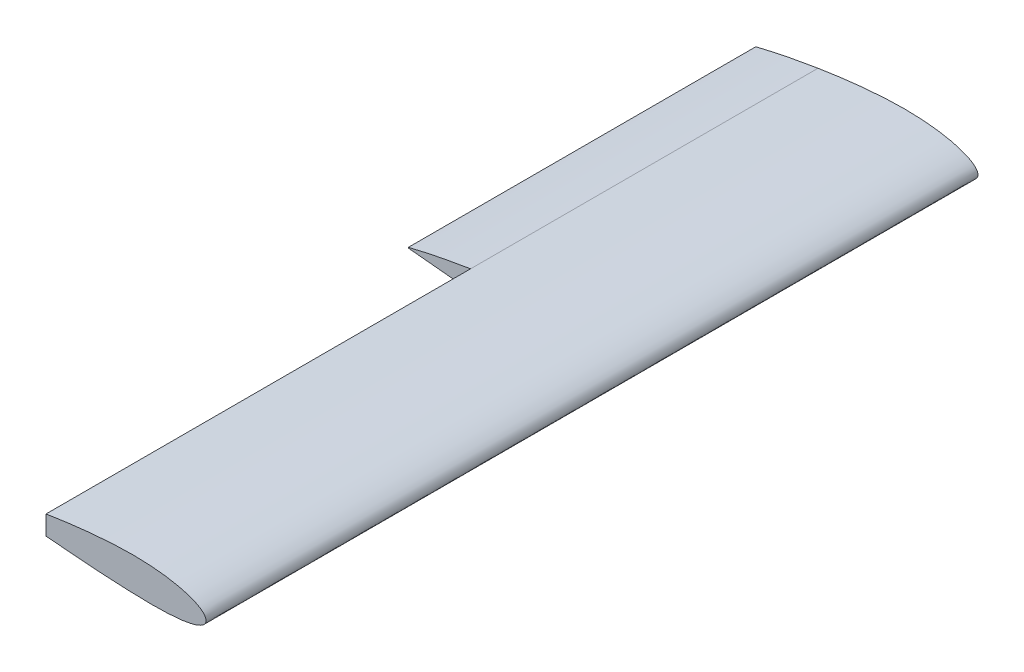
from build123d import *

# Parameters (mm, degrees)
BOSS_EXTRUDE1_DEPTH = 1120
BOSS_EXTRUDE2_DEPTH = 504
SKETCH3_R           = 12.7
CUT_EXTRUDE1_DEPTH  = 801
SKETCH4_W           = 32
SKETCH4_H           = 40.882
CUT_EXTRUDE2_DEPTH  = 46
SKETCH5_W           = 60
SKETCH5_H           = 12
CUT_EXTRUDE3_DEPTH  = 46
SKETCH6_W           = 54
SKETCH6_H           = 29.1
CUT_EXTRUDE4_DEPTH  = 64
SKETCH7_W           = 20.4
SKETCH7_H           = 6.8
CUT_EXTRUDE5_DEPTH  = 26


with BuildPart() as part:
    # Sketch1 → Boss-Extrude1 (new body)
    with BuildSketch(Plane.XY):
        with BuildLine():
            Line((-232.07976, 18.640331755), (-232.07976, -9.299539429))
            add(Edge.make_bspline(
                [(-232.07976, 18.640331755), (-229.164273263, 19.105137392), (-222.291133752, 20.200897474), (-211.337542784, 21.800276655), (-199.146674743, 23.458907068), (-186.709533826, 24.99775787), (-174.104063941, 26.396384265), (-161.408619673, 27.628181699), (-148.702826871, 28.669998803), (-136.048616227, 29.498668375), (-123.502304929, 30.100378699), (-111.141296499, 30.381034684), (-99.066442851, 30.337763188), (-87.381824011, 29.96392256), (-76.165988678, 29.262541202), (-65.494170353, 28.242118376), (-55.437562328, 26.917551706), (-46.062520993, 25.309550624), (-37.429846456, 23.444065126), (-29.594109363, 21.3513396), (-22.603015821, 19.064676337), (-16.496733591, 16.618893003), (-11.307130205, 14.048195179), (-7.056738632, 11.383320116), (-3.758682454, 8.645345207), (-1.421067217, 5.837729222), (-0.076519927, 2.93397469), (0.175352503, -0.017611891), (-0.655158047, -2.858555013), (-2.530689177, -5.439611815), (-5.336827593, -7.743904666), (-9.03994776, -9.814562437), (-13.624875961, -11.664753347), (-19.070291538, -13.294987869), (-25.346462309, -14.70103051), (-32.416774291, -15.879078453), (-40.239338685, -16.827563542), (-48.768060709, -17.548259209), (-57.953346605, -18.046825288), (-67.742561923, -18.333070043), (-78.080327008, -18.420905027), (-88.908707336, -18.328114372), (-100.167316867, -18.075575791), (-111.793460515, -17.687481617), (-123.745328455, -17.185705506), (-135.973510615, -16.604056476), (-148.402819763, -15.890368868), (-160.93563744, -15.074548453), (-173.478390843, -14.17792148), (-185.955186825, -13.221857076), (-198.290086365, -12.225761595), (-210.407470499, -11.20618891), (-221.646872664, -10.232436467), (-228.837861155, -9.589426373), (-232.07976, -9.299539429)],
                knots=[0, 0, 0, 0, 0.018424224, 0.043434346, 0.069080412, 0.095203092, 0.121640117, 0.148227444, 0.17480049, 0.201195447, 0.227363977, 0.253181792, 0.278347264, 0.302710399, 0.326128333, 0.348466602, 0.369600377, 0.389415723, 0.407811011, 0.424698681, 0.44000774, 0.453687637, 0.465714725, 0.476103672, 0.484928355, 0.492360154, 0.498730164, 0.504586951, 0.510443348, 0.516803825, 0.524198712, 0.532940661, 0.543185695, 0.554995644, 0.568376342, 0.583298542, 0.599709376, 0.617538825, 0.636703502, 0.65710892, 0.678650912, 0.701216586, 0.724685048, 0.748928058, 0.7738107, 0.799337901, 0.825325561, 0.851504471, 0.877716004, 0.903800001, 0.929595993, 0.954944401, 0.979687675, 1, 1, 1, 1], degree=3))
        make_face()
    extrude(amount=BOSS_EXTRUDE1_DEPTH)

    # Sketch2 → Boss-Extrude2 (add)
    with BuildSketch(Plane.XY):
        with BuildLine():
            Line((-232.07976, 18.640331755), (-232.07976, -9.299539429))
            add(Edge.make_bspline(
                [(-232.07976, -9.299539429), (-232.665749528, -9.247457079), (-236.934557579, -8.868048329), (-244.715948926, -8.155780655), (-255.233547628, -7.182675415), (-265.178963193, -6.244796096), (-274.489444659, -5.35296602), (-283.105666868, -4.514522896), (-290.972478934, -3.737169374), (-298.039247191, -3.028597089), (-304.260184667, -2.39533485), (-309.594932862, -1.846814612), (-314.008232694, -1.38276071), (-317.472079994, -1.027677658), (-319.961203892, -0.741044399), (-321.464120443, -0.620061141), (-322.14198951, -0.505870173), (-322.321741193, -0.506509982), (-322.333, -0.506550056)],
                knots=[0, 0, 0, 0, 0.019462551, 0.14178051, 0.258505433, 0.368899529, 0.472261554, 0.567931303, 0.655293986, 0.733784513, 0.802891701, 0.862162346, 0.911205133, 0.949694244, 0.977372582, 0.994054454, 0.999627599, 1, 1, 1, 1], degree=3))
            Line((-322.333, -0.506550056), (-322.333, 0.514797488))
            add(Edge.make_bspline(
                [(-232.07976, 18.640331755), (-232.997104276, 18.496640375), (-237.59945591, 17.775735177), (-245.697898879, 16.398726282), (-256.18174484, 14.549633525), (-266.070518156, 12.708392515), (-275.306517101, 10.911856103), (-283.834257123, 9.183893288), (-291.603294753, 7.551136168), (-298.567863892, 6.038773121), (-304.687234469, 4.671058189), (-309.925850109, 3.470601356), (-314.253461721, 2.457844833), (-317.645235976, 1.650544318), (-320.081782459, 1.063070488), (-321.538022536, 0.709024901), (-322.180548986, 0.552044036), (-322.333, 0.514797488)],
                knots=[0, 0, 0, 0, 0.030251696, 0.151773928, 0.267626296, 0.377089872, 0.479484952, 0.574174897, 0.660569789, 0.738129949, 0.806369318, 0.864858701, 0.913228834, 0.951173208, 0.978450569, 0.994887008, 1, 1, 1, 1], degree=3))
        make_face()
    extrude(amount=BOSS_EXTRUDE2_DEPTH)

    # Sketch3 → Cut-Extrude1 (cut)
    with BuildSketch(Plane.XY):
        with Locations((-96.7, 6.044)):
            Circle(SKETCH3_R)
    extrude(amount=CUT_EXTRUDE1_DEPTH, mode=Mode.SUBTRACT)

    # Sketch4 → Cut-Extrude2 (cut)
    with BuildSketch(Plane.XY.offset(330.7)):
        with Locations((-96.7, 1.303)):
            Rectangle(SKETCH4_W, SKETCH4_H)
    extrude(amount=CUT_EXTRUDE2_DEPTH, mode=Mode.SUBTRACT)

    # Sketch5 → Cut-Extrude3 (cut)
    with BuildSketch(Plane.XY.offset(330.7)):
        with Locations((-257.8664, -2.987)):
            Rectangle(SKETCH5_W, SKETCH5_H)
    extrude(amount=CUT_EXTRUDE3_DEPTH, mode=Mode.SUBTRACT)

    # Sketch6 → Cut-Extrude4 (cut)
    with BuildSketch(Plane.XY.offset(534.5)):
        with Locations((-177.283, -2.36)):
            Rectangle(SKETCH6_W, SKETCH6_H)
    extrude(amount=CUT_EXTRUDE4_DEPTH, mode=Mode.SUBTRACT)

    # Sketch7 → Cut-Extrude5 (cut)
    with BuildSketch(Plane.XY.offset(-0.5)):
        with Locations((-225.633, 4.835)):
            Rectangle(SKETCH7_W, SKETCH7_H)
    extrude(amount=CUT_EXTRUDE5_DEPTH, mode=Mode.SUBTRACT)


solid = part.part
